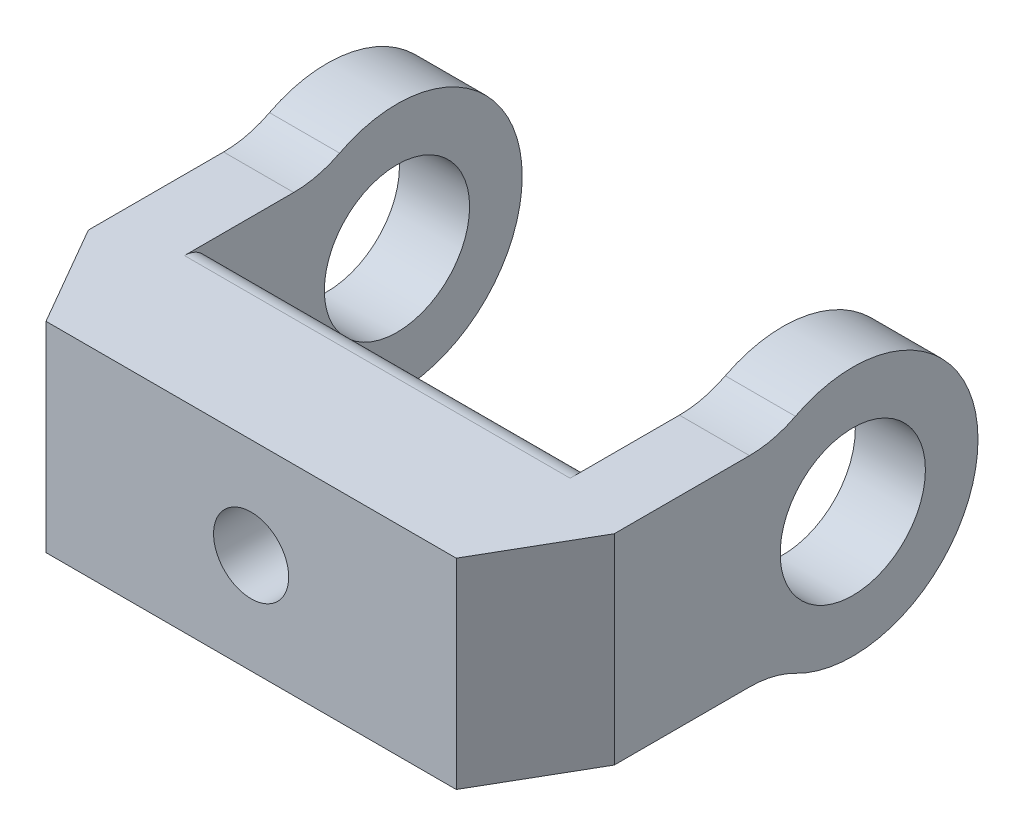
from build123d import *
from OCP.BRepFilletAPI import BRepFilletAPI_MakeChamfer

# Parameters (mm, degrees)
SKETCH1_W               = 21
SKETCH1_H               = 4.523364486
BOSS_EXTRUDE1_DEPTH     = 8
SKETCH2_W               = 2.8
SKETCH2_H               = 8
BOSS_EXTRUDE2_DEPTH     = 10
SKETCH3_R               = 2.9
CUT_EXTRUDE1_DEPTH      = 34
FILLET1_R               = 4
SKETCH4_R               = 8
CUT_EXTRUDE2_DEPTH      = 15.4
FILLET2_R               = 1
SKETCH6_W               = 21
SKETCH6_H               = 8
BOSS_EXTRUDE3_DEPTH     = 3
SKETCH7_R               = 1.5
CUT_EXTRUDE3_DEPTH      = 12
CUT_EXTRUDE4_DEPTH      = 2.8
CUT_EXTRUDE4_DEPTH_BACK = 12
SKETCH8_R               = 3
SKETCH9_R               = 2.75
BOSS_EXTRUDE4_DEPTH     = 3
CHAMFER1_SIZE           = 4
CHAMFER1_SIZE2          = 2.309401077
SKETCH10_R              = 5
SKETCH10_R_2            = 2.9
BOSS_EXTRUDE5_DEPTH     = 2.8
BOSS_EXTRUDE6_START     = -2.8
SKETCH11_R              = 5
SKETCH11_R_2            = 2.9
BOSS_EXTRUDE6_DEPTH     = 2.8
FILLET3_R               = 4


with BuildPart() as part:
    # Sketch1 → Boss-Extrude1 (new body)
    with BuildSketch(Plane(origin=(0, 0, 0), x_dir=(1, 0, 0), z_dir=(0, 1, 0))):
        Rectangle(SKETCH1_W, SKETCH1_H)
    extrude(amount=BOSS_EXTRUDE1_DEPTH)

    # Sketch2 → Boss-Extrude2 (add)
    with BuildSketch(Plane(origin=(0, 0, -2.261682243), x_dir=(-1, 0, 0), z_dir=(0, 0, -1))):
        with Locations((9.1, 4)):
            Rectangle(SKETCH2_W, SKETCH2_H)
        with Locations((-9.1, 4)):
            Rectangle(SKETCH2_W, SKETCH2_H)
    extrude(amount=BOSS_EXTRUDE2_DEPTH)

    # Sketch3 → Cut-Extrude1 (cut)
    with BuildSketch(Plane(origin=(10.5, 0, 0), x_dir=(0, 0, -1), z_dir=(1, 0, 0))):
        with Locations((8.261682243, 4)):
            Circle(SKETCH3_R)
    extrude(amount=-CUT_EXTRUDE1_DEPTH, mode=Mode.SUBTRACT)

    # Fillet1
    fillet1_edges = [part.edges().sort_by_distance(p)[0] for p in [
        (9.1, 0, -12.261682243),
        (-9.1, 0, -12.261682243),
        (-9.1, 8, -12.261682243),
        (9.1, 8, -12.261682243),
    ]]
    fillet(fillet1_edges, radius=FILLET1_R - 0.0001)  # a hair under: the kernel refuses the full size

    # Sketch4 → Cut-Extrude2 (cut)
    with BuildSketch(Plane.ZY.offset(-7.7)):
        with Locations((-8.261682243, 4)):
            Circle(SKETCH4_R)
    extrude(amount=CUT_EXTRUDE2_DEPTH, mode=Mode.SUBTRACT)

    # Fillet2
    fillet2_edges = [part.edges().sort_by_distance(p)[0] for p in [
        (0, 0, -1.333479013),
        (0, 8, -1.333479013),
    ]]
    fillet(fillet2_edges, radius=FILLET2_R)

    # Sketch6 → Boss-Extrude3 (add)
    with BuildSketch(Plane.XY.offset(2.261682243)):
        with Locations((0, 4)):
            Rectangle(SKETCH6_W, SKETCH6_H)
    extrude(amount=BOSS_EXTRUDE3_DEPTH)

    # Sketch7 → Cut-Extrude3 (cut)
    with BuildSketch(Plane.XY.offset(5.261682243)):
        with Locations((0, 4)):
            Circle(SKETCH7_R)
    extrude(amount=-CUT_EXTRUDE3_DEPTH, mode=Mode.SUBTRACT)

    # Sketch8 → Cut-Extrude4 (cut, two sides: drawn at the far end of the back side and taken through both)
    with BuildSketch(Plane.XY.offset(-CUT_EXTRUDE4_DEPTH_BACK)):
        with Locations(Location((0, 4, 0), (0, 0, 117.266044451))):
            Circle(SKETCH8_R)
    extrude(amount=CUT_EXTRUDE4_DEPTH + CUT_EXTRUDE4_DEPTH_BACK, mode=Mode.SUBTRACT)

    # Chamfer1: one chamfer whose edges measure the first distance from different faces: ONE call of the kernel's chamfer builder (chamfer() names one face for all edges)
    chamfer1_edges_1 = [part.edges().sort_by_distance(p)[0] for p in [
        (-10.5, 4, 5.261682243),
    ]]
    chamfer1_side_1 = [part.faces().sort_by_distance(p)[0] for p in [
        (-10.5, 4, -1.817687079),
    ]]
    chamfer1_edges_2 = [part.edges().sort_by_distance(p)[0] for p in [
        (10.5, 4, 5.261682243),
    ]]
    chamfer1_side_2 = [part.faces().sort_by_distance(p)[0] for p in [
        (10.5, 4, -1.817687079),
    ]]
    chamfer1 = BRepFilletAPI_MakeChamfer(part.part.solid().wrapped)
    for e in chamfer1_edges_1:
        chamfer1.Add(CHAMFER1_SIZE, CHAMFER1_SIZE2, e.wrapped, chamfer1_side_1[0].wrapped)  # the first distance lies on this face
    for e in chamfer1_edges_2:
        chamfer1.Add(CHAMFER1_SIZE, CHAMFER1_SIZE2, e.wrapped, chamfer1_side_2[0].wrapped)  # the first distance lies on this face
    add(Compound.cast(chamfer1.Shape()), mode=Mode.REPLACE)

    # Sketch10 → Boss-Extrude5 (add)
    with BuildSketch(Plane(origin=(10.5, 0, 0), x_dir=(0, 0, -1), z_dir=(1, 0, 0))):
        with Locations((8.261682243, 4)):
            Circle(SKETCH10_R)
        with Locations((8.261682243, 4)):
            Circle(SKETCH10_R_2, mode=Mode.SUBTRACT)
    extrude(amount=-BOSS_EXTRUDE5_DEPTH)

    # Sketch11 → Boss-Extrude6 (add)
    with BuildSketch(Plane.ZY.offset(10.5).offset(BOSS_EXTRUDE6_START)):
        with Locations((-8.261682243, 4)):
            Circle(SKETCH11_R)
        with Locations(Location((-8.261682243, 4, 0), (0, 0, 180))):
            Circle(SKETCH11_R_2, mode=Mode.SUBTRACT)
    extrude(amount=BOSS_EXTRUDE6_DEPTH)

    # Fillet3
    fillet3_edges = [part.edges().sort_by_distance(p)[0] for p in [
        (9.1, 0, -5.261682243),
        (9.1, 8, -5.261682243),
        (-9.1, 0, -5.261682243),
        (-9.1, 8, -5.261682243),
    ]]
    fillet(fillet3_edges, radius=FILLET3_R)


with BuildPart() as body_2:
    # Sketch9 → Boss-Extrude4 (new body)
    with BuildSketch(Plane(origin=(0, 0, 2.8), x_dir=(-1, 0, 0), z_dir=(0, 0, -1))):
        with Locations((0, 4)):
            Circle(SKETCH9_R)
    extrude(amount=BOSS_EXTRUDE4_DEPTH)


solid = Compound([part.part, body_2.part])
